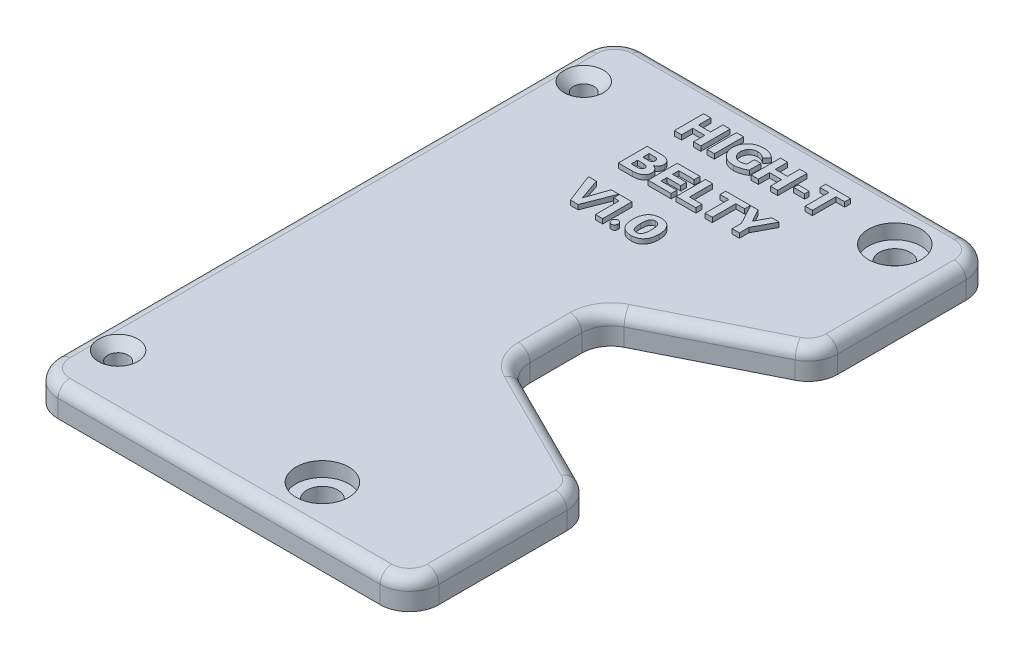
from build123d import *

# Parameters (mm, degrees)
SKETCH2_W           = 65
SKETCH2_H           = 100
SKETCH2_R           = 1.75
SKETCH2_R_2         = 2.65
BOSS_EXTRUDE1_DEPTH = 5
SKETCH3_R           = 4.5
CUT_EXTRUDE1_DEPTH  = 2.5
FILLET1_R           = 5
CHAMFER1_SIZE       = 1.6
CUT_EXTRUDE2_DEPTH  = 60.843546018
FILLET3_R           = 5
FILLET2_R           = 2
SKETCH4_W           = 1.231467233
SKETCH4_H           = 5
SKETCH4_W_2         = 1.890445816
SKETCH4_H_2         = 0.775761863
BOSS_EXTRUDE2_DEPTH = 0.8


with BuildPart() as part:
    # Sketch2 → Boss-Extrude1 (new body)
    with BuildSketch(Plane(origin=(0, 0, 0), x_dir=(1, 0, 0), z_dir=(0, 1, 0))):
        Rectangle(SKETCH2_W, SKETCH2_H)
        with Locations(Location((-27.5, 39.75, 0), (0, 0, 270))):
            Circle(SKETCH2_R, mode=Mode.SUBTRACT)
        with Locations(Location((-27.5, -39.75, 0), (0, 0, 270))):
            Circle(SKETCH2_R, mode=Mode.SUBTRACT)
        with Locations(Location((23.15, 42.205, 0), (0, 0, 270))):
            Circle(SKETCH2_R_2, mode=Mode.SUBTRACT)
        with Locations(Location((9.4375, -41.8075, 0), (0, 0, 270))):
            Circle(SKETCH2_R_2, mode=Mode.SUBTRACT)
    extrude(amount=BOSS_EXTRUDE1_DEPTH)

    # Sketch3 → Cut-Extrude1 (cut)
    with BuildSketch(Plane(origin=(0, 5, 0), x_dir=(1, 0, 0), z_dir=(0, 1, 0))):
        with Locations(Location((23.15, 42.205, 0), (0, 0, 270))):
            Circle(SKETCH3_R)
        with Locations(Location((9.4375, -41.8075, 0), (0, 0, 270))):
            Circle(SKETCH3_R)
    extrude(amount=-CUT_EXTRUDE1_DEPTH, mode=Mode.SUBTRACT)

    # Fillet1
    fillet1_edges = [part.edges().sort_by_distance(p)[0] for p in [
        (32.5, 2.5, 50),
        (-32.5, 2.5, 50),
        (-32.5, 2.5, -50),
        (32.5, 2.5, -50),
    ]]
    fillet(fillet1_edges, radius=FILLET1_R)

    # Chamfer1
    chamfer1_edges = [part.edges().sort_by_distance(p)[0] for p in [
        (-27.5, 5, -41.5),
        (-27.5, 5, 38),
    ]]
    chamfer(chamfer1_edges, length=CHAMFER1_SIZE)

    # Sketch6 → Cut-Extrude2 (cut, through all)
    with BuildSketch(Plane(origin=(0, 5, 0), x_dir=(1, 0, 0), z_dir=(0, 1, 0))):
        Polygon((7.5, 7.5), (32.5, 20), (32.5, -20), (7.5, -7.5), align=None)
    extrude(amount=-CUT_EXTRUDE2_DEPTH, mode=Mode.SUBTRACT)

    # Fillet3
    fillet3_edges = [part.edges().sort_by_distance(p)[0] for p in [
        (7.5, 2.5, 7.5),
        (7.5, 2.5, -7.5),
        (32.5, 2.5, -20),
        (32.5, 2.5, 20),
    ]]
    fillet(fillet3_edges, radius=FILLET3_R)

    # Fillet2
    # the kernel refuses this fillet: 2 mm, written as the material it takes off along each edge
    with BuildSketch(Plane(origin=(12.5, 5, -4.409830056), x_dir=(-1, 0, 0), z_dir=(0, 0, 1))) as fillet2_piece_1:
        with BuildLine():
            CenterArc((5 + FILLET2_R, FILLET2_R), FILLET2_R, 180, 90)
            Line((5, FILLET2_R), (5, 0))
            Line((5, 0), (5 + FILLET2_R, 0))
        make_face()
    revolve(axis=Axis((12.5, 5, -4.409830056), (0, -1, 0)), revolution_arc=63.434948823, mode=Mode.SUBTRACT)
    with BuildSketch(Plane(origin=(12.5, 5, 4.409830056), x_dir=(-0.447213595499958, 0, 0.894427190999916), z_dir=(0.894427190999916, 0, 0.447213595499958))) as fillet2_piece_2:
        with BuildLine():
            CenterArc((5 + FILLET2_R, FILLET2_R), FILLET2_R, 180, 90)
            Line((5, FILLET2_R), (5, 0))
            Line((5, 0), (5 + FILLET2_R, 0))
        make_face()
    revolve(axis=Axis((12.5, 5, 4.409830056), (0, -1, 0)), revolution_arc=63.434948823, mode=Mode.SUBTRACT)
    with BuildSketch(Plane(origin=(27.5, 5, 50), x_dir=(0, 0, -1), z_dir=(-1, 0, 0)), Plane(origin=(-27.5, 5, -50), x_dir=(0, 0, 1), z_dir=(1, 0, 0))) as fillet2_piece_3:
        with BuildLine():
            CenterArc((FILLET2_R, FILLET2_R), FILLET2_R, 180, 90)
            Line((0, FILLET2_R), (0, 0))
            Line((0, 0), (FILLET2_R, 0))
        make_face()
    extrude(amount=55, mode=Mode.SUBTRACT)
    with BuildSketch(Plane(origin=(-32.5, 5, 45), x_dir=(1, 0, 0), z_dir=(0, 0, -1))) as fillet2_piece_4:
        with BuildLine():
            CenterArc((FILLET2_R, FILLET2_R), FILLET2_R, 180, 90)
            Line((0, FILLET2_R), (0, 0))
            Line((0, 0), (FILLET2_R, 0))
        make_face()
    extrude(amount=90, mode=Mode.SUBTRACT)
    with BuildSketch(Plane(origin=(32.5, 5, 23.090169944), x_dir=(-1, 0, 0), z_dir=(0, 0, 1)), Plane(origin=(32.5, 5, -45), x_dir=(-1, 0, 0), z_dir=(0, 0, 1))) as fillet2_piece_5:
        with BuildLine():
            CenterArc((FILLET2_R, FILLET2_R), FILLET2_R, 180, 90)
            Line((0, FILLET2_R), (0, 0))
            Line((0, 0), (FILLET2_R, 0))
        make_face()
    extrude(amount=21.909830056, mode=Mode.SUBTRACT)
    with BuildSketch(Plane(origin=(27.5, 5, 45), x_dir=(1, 0, 0), z_dir=(0, 0, -1))) as fillet2_piece_6:
        with BuildLine():
            CenterArc((5 - FILLET2_R, FILLET2_R), FILLET2_R, 270, 90)
            Line((5, FILLET2_R), (5, 0))
            Line((5, 0), (5 - FILLET2_R, 0))
        make_face()
    revolve(axis=Axis((27.5, 5, 45), (0, -1, 0)), revolution_arc=90, mode=Mode.SUBTRACT)
    with BuildSketch(Plane(origin=(27.5, 5, -45), x_dir=(0, 0, -1), z_dir=(-1, 0, 0))) as fillet2_piece_7:
        with BuildLine():
            CenterArc((5 - FILLET2_R, FILLET2_R), FILLET2_R, 270, 90)
            Line((5, FILLET2_R), (5, 0))
            Line((5, 0), (5 - FILLET2_R, 0))
        make_face()
    revolve(axis=Axis((27.5, 5, -45), (0, -1, 0)), revolution_arc=90, mode=Mode.SUBTRACT)
    with BuildSketch(Plane(origin=(-27.5, 5, -45), x_dir=(0, 0, -1), z_dir=(1, 0, 0))) as fillet2_piece_8:
        with BuildLine():
            CenterArc((5 - FILLET2_R, -FILLET2_R), FILLET2_R, 0, 90)
            Line((5, -FILLET2_R), (5, 0))
            Line((5, 0), (5 - FILLET2_R, 0))
        make_face()
    revolve(axis=Axis((-27.5, 5, -45), (0, 1, 0)), revolution_arc=90, mode=Mode.SUBTRACT)
    with BuildSketch(Plane(origin=(-27.5, 5, 45), x_dir=(-1, 0, 0), z_dir=(0, 0, -1))) as fillet2_piece_9:
        with BuildLine():
            CenterArc((5 - FILLET2_R, -FILLET2_R), FILLET2_R, 0, 90)
            Line((5, -FILLET2_R), (5, 0))
            Line((5, 0), (5 - FILLET2_R, 0))
        make_face()
    revolve(axis=Axis((-27.5, 5, 45), (0, 1, 0)), revolution_arc=90, mode=Mode.SUBTRACT)
    with BuildSketch(Plane(origin=(10.263932023, 5, -8.881966011), x_dir=(-0.44721359549995804, 0, -0.8944271909999159), z_dir=(0.8944271909999159, 0, -0.447213595499958)), Plane(origin=(29.736067977, 5, 18.618033989), x_dir=(-0.447213595499958, 0, 0.8944271909999159), z_dir=(-0.8944271909999159, 0, -0.447213595499958))) as fillet2_piece_10:
        with BuildLine():
            CenterArc((FILLET2_R, -FILLET2_R), FILLET2_R, 90, 90)
            Line((0, -FILLET2_R), (0, 0))
            Line((0, 0), (FILLET2_R, 0))
        make_face()
    extrude(amount=21.770509831, mode=Mode.SUBTRACT)
    with BuildSketch(Plane(origin=(7.5, 5, 4.409830056), x_dir=(-1, 0, 0), z_dir=(0, 0, -1))) as fillet2_piece_11:
        with BuildLine():
            CenterArc((FILLET2_R, -FILLET2_R), FILLET2_R, 90, 90)
            Line((0, -FILLET2_R), (0, 0))
            Line((0, 0), (FILLET2_R, 0))
        make_face()
    extrude(amount=8.819660113, mode=Mode.SUBTRACT)
    with BuildSketch(Plane(origin=(27.5, 5, 23.090169944), x_dir=(1, 0, 0), z_dir=(0, 0, 1))) as fillet2_piece_12:
        with BuildLine():
            CenterArc((5 - FILLET2_R, -FILLET2_R), FILLET2_R, 0, 90)
            Line((5, -FILLET2_R), (5, 0))
            Line((5, 0), (5 - FILLET2_R, 0))
        make_face()
    revolve(axis=Axis((27.5, 5, 23.090169944), (0, 1, 0)), revolution_arc=63.434948823, mode=Mode.SUBTRACT)
    with BuildSketch(Plane(origin=(27.5, 5, -23.090169944), x_dir=(0.447213595499958, 0, 0.894427190999916), z_dir=(-0.894427190999916, 0, 0.447213595499958))) as fillet2_piece_13:
        with BuildLine():
            CenterArc((5 - FILLET2_R, -FILLET2_R), FILLET2_R, 0, 90)
            Line((5, -FILLET2_R), (5, 0))
            Line((5, 0), (5 - FILLET2_R, 0))
        make_face()
    revolve(axis=Axis((27.5, 5, -23.090169944), (0, 1, 0)), revolution_arc=63.434948823, mode=Mode.SUBTRACT)

    # Sketch4 → Boss-Extrude2 (add)
    # profile 1 of 15: a face of its own
    with BuildSketch(Plane(origin=(0, 5, 0), x_dir=(1, 0, 0), z_dir=(0, 1, 0))):
        Polygon((-7.166483743, 39.40635341), (-7.166483743, 44.40635341), (-8.397950976, 44.40635341), (-8.397950976, 42.297622949), (-10.461375654, 42.297622949), (-10.461375654, 44.40635341), (-11.692842887, 44.40635341), (-11.692842887, 39.40635341), (-10.461375654, 39.40635341), (-10.461375654, 41.317391301), (-8.397950976, 41.317391301), (-8.397950976, 39.40635341), align=None)
    # profile 2 of 15: a face of its own
    with BuildSketch(Plane(origin=(0, 5, 0), x_dir=(1, 0, 0), z_dir=(0, 1, 0))):
        with Locations((-5.475791314, 41.90635341)):
            Rectangle(SKETCH4_W, SKETCH4_H)
    # profile 3 of 15: a face of its own
    with BuildSketch(Plane(origin=(0, 5, 0), x_dir=(1, 0, 0), z_dir=(0, 1, 0))):
        with BuildLine():
            Line((-0.556105836, 41.957400721), (-0.556105836, 40.634993116))
            add(Edge.make_bspline(
                [(-0.556105836, 40.634993116), (-0.633336255, 40.598588973), (-0.784947168, 40.527124058), (-0.982142373, 40.462368321), (-1.13658966, 40.422342839), (-1.248035296, 40.404046551), (-1.354358334, 40.388700079), (-1.424048895, 40.387279007), (-1.458080761, 40.386585058)],
                knots=[0, 0, 0, 0, 1.628199153, 3.196315169, 3.95256349, 4.670894267, 5.350960203, 6, 6, 6, 6], degree=3))
            add(Edge.make_bspline(
                [(-1.458080761, 40.386585058), (-1.511022372, 40.388648552), (-1.614635544, 40.39268706), (-1.766312975, 40.416071933), (-1.910455868, 40.45177804), (-2.047560246, 40.500767211), (-2.177564019, 40.561177574), (-2.300220724, 40.635299574), (-2.415979113, 40.721641369), (-2.522386397, 40.821923033), (-2.619986674, 40.93096029), (-2.704747572, 41.049282219), (-2.777536704, 41.174639772), (-2.8371516, 41.307966526), (-2.884701161, 41.448644137), (-2.919531349, 41.596872171), (-2.942882052, 41.752568065), (-2.946949194, 41.859249645), (-2.949019805, 41.913561994)],
                knots=[0, 0, 0, 0, 1.067772952, 2.089761565, 3.08863466, 4.058499339, 5.021522729, 5.974745117, 6.943794358, 7.928172758, 8.918592206, 9.890603398, 10.858193022, 11.837202932, 12.830954615, 13.84836214, 14.904585896, 16, 16, 16, 16], degree=3))
            add(Edge.make_bspline(
                [(-2.949019805, 41.913561994), (-2.946969615, 41.966853375), (-2.94293058, 42.071841572), (-2.919158148, 42.224945561), (-2.886132664, 42.371494272), (-2.837837332, 42.509639476), (-2.77964043, 42.641705889), (-2.70663793, 42.765178778), (-2.623140491, 42.882791903), (-2.526558325, 42.990868506), (-2.420905654, 43.089649342), (-2.306968608, 43.176954693), (-2.18540171, 43.250961457), (-2.056850204, 43.312490735), (-1.920810725, 43.359359484), (-1.778413588, 43.395867274), (-1.628348375, 43.418881351), (-1.525774476, 43.422997462), (-1.473525571, 43.425094119)],
                knots=[0, 0, 0, 0, 1.086646364, 2.140778484, 3.154281091, 4.145845613, 5.12011741, 6.092426418, 7.065490814, 8.057055335, 9.042500024, 10.011174974, 10.978635539, 11.939720885, 12.911450365, 13.907868944, 14.934314136, 16, 16, 16, 16], degree=3))
            add(Edge.make_bspline(
                [(-1.473525571, 43.425094119), (-1.413364463, 43.422853078), (-1.292429558, 43.418348174), (-1.111603072, 43.389740707), (-0.931838258, 43.342920716), (-0.754314018, 43.27928401), (-0.581987588, 43.199315552), (-0.418206206, 43.104248415), (-0.262665189, 42.995917982), (-0.16817464, 42.912264293), (-0.120560168, 42.870110594)],
                knots=[0, 0, 0, 0, 0.96562137, 1.94107673, 2.931153581, 3.943538676, 4.963910889, 5.975876231, 6.980029377, 8, 8, 8, 8], degree=3))
            Line((-0.120560168, 42.870110594), (0.593385249, 43.681477974))
            add(Edge.make_bspline(
                [(0.593385249, 43.681477974), (0.525574001, 43.743149713), (0.389861266, 43.86657526), (0.161508345, 44.023559988), (-0.083022078, 44.160745141), (-0.345351627, 44.271552152), (-0.617706092, 44.359465882), (-0.896570806, 44.424094187), (-1.180004755, 44.462984074), (-1.37078575, 44.468473719), (-1.466317993, 44.47122262)],
                knots=[0, 0, 0, 0, 0.972849732, 1.946994061, 2.936193159, 3.947412972, 4.966791559, 5.973392175, 6.985190369, 8, 8, 8, 8], degree=3))
            add(Edge.make_bspline(
                [(-1.466317993, 44.47122262), (-1.566307619, 44.467692848), (-1.762149568, 44.460779357), (-2.048085683, 44.42324015), (-2.319330878, 44.364235048), (-2.577131321, 44.285863322), (-2.819435914, 44.182711095), (-3.049142452, 44.061576238), (-3.262582949, 43.916138969), (-3.461073372, 43.752283139), (-3.639933529, 43.570235446), (-3.797461175, 43.373714915), (-3.932194012, 43.163765193), (-4.043239731, 42.939738128), (-4.129388235, 42.701847537), (-4.193252499, 42.450821685), (-4.235397973, 42.186744034), (-4.243360904, 42.005701481), (-4.247413545, 41.913561994)],
                knots=[0, 0, 0, 0, 1.136686362, 2.226339683, 3.272298926, 4.28902103, 5.283773391, 6.261078626, 7.23592056, 8.213879552, 9.182111569, 10.131288083, 11.071645943, 12.011971438, 12.967157077, 13.941678949, 14.952441609, 16, 16, 16, 16], degree=3))
            add(Edge.make_bspline(
                [(-4.247413545, 41.913561994), (-4.243163808, 41.820765726), (-4.234833054, 41.638857299), (-4.195613851, 41.372843774), (-4.132365611, 41.120687441), (-4.04838882, 40.881519079), (-3.940191112, 40.656365988), (-3.810202318, 40.444792976), (-3.657723314, 40.246299241), (-3.482827344, 40.064444658), (-3.291062423, 39.898386867), (-3.082738479, 39.754160457), (-2.86173366, 39.629138157), (-2.625620515, 39.529109643), (-2.377115856, 39.447668255), (-2.114547322, 39.390187839), (-1.838502069, 39.350442012), (-1.649395599, 39.343832423), (-1.552808932, 39.340456557)],
                knots=[0, 0, 0, 0, 1.070303225, 2.098114301, 3.093148994, 4.062915008, 5.014925995, 5.966904099, 6.920434657, 7.89421925, 8.870459961, 9.839547862, 10.810209228, 11.792029461, 12.790416868, 13.820296925, 14.886710456, 16, 16, 16, 16], degree=3))
            add(Edge.make_bspline(
                [(-1.552808932, 39.340456557), (-1.461050732, 39.342958399), (-1.275864852, 39.348007602), (-0.99807576, 39.385511078), (-0.717308571, 39.439153532), (-0.438711814, 39.516591587), (-0.167810466, 39.609586188), (0.087374557, 39.718129815), (0.324796501, 39.838506739), (0.470847394, 39.932637578), (0.542537031, 39.97884206)],
                knots=[0, 0, 0, 0, 0.991981442, 2.002011336, 3.026893716, 4.081264979, 5.125916695, 6.122062403, 7.078207169, 8, 8, 8, 8], degree=3))
            Line((0.542537031, 39.97884206), (0.54356568, 41.957400721))
            Line((0.54356568, 41.957400721), (-0.556105836, 41.957400721))
        make_face()
    # profile 4 of 15: a face of its own
    with BuildSketch(Plane(origin=(0, 5, 0), x_dir=(1, 0, 0), z_dir=(0, 1, 0))):
        Polygon((5.947190062, 39.40635341), (5.947190062, 44.40635341), (4.715722829, 44.40635341), (4.715722829, 42.297622949), (2.652298152, 42.297622949), (2.652298152, 44.40635341), (1.420830919, 44.40635341), (1.420830919, 39.40635341), (2.652298152, 39.40635341), (2.652298152, 41.317391301), (4.715722829, 41.317391301), (4.715722829, 39.40635341), align=None)
    # profile 5 of 15: a face of its own
    with BuildSketch(Plane(origin=(0, 5, 0), x_dir=(1, 0, 0), z_dir=(0, 1, 0))):
        with Locations((7.835576067, 41.576864119)):
            Rectangle(SKETCH4_W_2, SKETCH4_H_2)
    # profile 6 of 15: a face of its own
    with BuildSketch(Plane(origin=(0, 5, 0), x_dir=(1, 0, 0), z_dir=(0, 1, 0))):
        Polygon((13.379702474, 43.426121762), (13.379702474, 44.40635341), (9.159061088, 44.40635341), (9.159061088, 43.426121762), (10.646531084, 43.426121762), (10.646531084, 39.40635341), (11.877998316, 39.40635341), (11.877998316, 43.426121762), align=None)
    # profile 7 of 15: a face of its own
    with BuildSketch(Plane(origin=(0, 5, 0), x_dir=(1, 0, 0), z_dir=(0, 1, 0))):
        with BuildLine():
            Line((-11.692842887, 34.77373397), (-11.692842887, 29.842228085))
            Line((-11.692842887, 29.842228085), (-9.275099575, 29.842228085))
            add(Edge.make_bspline(
                [(-9.275099575, 29.842228085), (-9.202675299, 29.843533916), (-9.061662971, 29.846076411), (-8.856415662, 29.8650404), (-8.663035063, 29.894466453), (-8.481773911, 29.935697791), (-8.312069197, 29.986653957), (-8.154628414, 30.049776003), (-8.008860479, 30.123700042), (-7.875675433, 30.209249887), (-7.756508878, 30.304419501), (-7.652034792, 30.408562408), (-7.562840334, 30.520814491), (-7.490284062, 30.642543611), (-7.433194444, 30.772236034), (-7.391974837, 30.91055887), (-7.365812701, 31.05709661), (-7.361315902, 31.157824743), (-7.359028043, 31.209072702)],
                knots=[0, 0, 0, 0, 1.31778807, 2.565774578, 3.747698678, 4.87499037, 5.945847535, 6.968804334, 7.957633534, 8.915706071, 9.844314641, 10.727602835, 11.594778639, 12.446339008, 13.299295435, 14.166741106, 15.067283635, 16, 16, 16, 16], degree=3))
            add(Edge.make_bspline(
                [(-7.359028043, 31.209072702), (-7.359999721, 31.248255838), (-7.361907194, 31.325175035), (-7.377400443, 31.437567806), (-7.398304291, 31.545977119), (-7.429746457, 31.649325843), (-7.467231789, 31.749128322), (-7.515408597, 31.843147697), (-7.57110719, 31.933112847), (-7.634825941, 32.01819852), (-7.705382234, 32.0979524), (-7.784636008, 32.16847436), (-7.86810518, 32.234371531), (-7.958849665, 32.29190405), (-8.056248887, 32.34144949), (-8.159825323, 32.383266598), (-8.268837538, 32.420269001), (-8.344901603, 32.437125796), (-8.383533809, 32.4456872)],
                knots=[0, 0, 0, 0, 1.074137907, 2.108606731, 3.107339287, 4.099127461, 5.067591067, 6.027415709, 6.991293761, 7.966504418, 8.939759604, 9.90602486, 10.871969105, 11.853835331, 12.847364151, 13.864731711, 14.915517818, 16, 16, 16, 16], degree=3))
            add(Edge.make_bspline(
                [(-8.383533809, 32.4456872), (-8.323302329, 32.467100453), (-8.205274096, 32.509061375), (-8.045185713, 32.603981276), (-7.903876198, 32.719336725), (-7.804073132, 32.834032603), (-7.736078182, 32.935032411), (-7.69045858, 33.014776855), (-7.650996919, 33.097778236), (-7.620335904, 33.185326431), (-7.595559639, 33.276168741), (-7.576933799, 33.371088858), (-7.565436194, 33.469913435), (-7.563752128, 33.537089901), (-7.562899542, 33.571099061)],
                knots=[0, 0, 0, 0, 1.535350456, 3.008637708, 4.452220897, 5.909889534, 6.647551199, 7.380061954, 8.119063438, 8.855799671, 9.609200867, 10.383501593, 11.181621827, 12, 12, 12, 12], degree=3))
            add(Edge.make_bspline(
                [(-7.562899542, 33.571099061), (-7.564849765, 33.616854059), (-7.568676495, 33.706634544), (-7.593724027, 33.837248705), (-7.634746613, 33.959515193), (-7.687679035, 34.075521179), (-7.759019551, 34.181467385), (-7.843226687, 34.28073848), (-7.94317967, 34.371577638), (-8.057286135, 34.454441619), (-8.184679884, 34.528657251), (-8.323625695, 34.593317063), (-8.473720982, 34.64749073), (-8.634231214, 34.693383537), (-8.806192685, 34.72742265), (-8.989010751, 34.753430154), (-9.182979818, 34.768635527), (-9.316031258, 34.771324464), (-9.384357532, 34.772705322)],
                knots=[0, 0, 0, 0, 0.900623983, 1.767204946, 2.606846164, 3.434992404, 4.268851201, 5.112316324, 5.992174589, 6.920550345, 7.883462853, 8.889971672, 9.933005182, 11.021585561, 12.173010109, 13.380719405, 14.654913598, 16, 16, 16, 16], degree=3))
            Line((-9.384357532, 34.772705322), (-11.692842887, 34.77373397))
        make_face()
        with BuildLine():
            Line((-10.461375654, 33.85940018), (-9.453891356, 33.85940018))
            add(Edge.make_bspline(
                [(-9.453891356, 33.85940018), (-9.410321619, 33.857236569), (-9.327359525, 33.85311679), (-9.210153966, 33.827333375), (-9.106766194, 33.785298968), (-9.019226942, 33.72468492), (-8.947176301, 33.649078598), (-8.897446661, 33.556115272), (-8.865229914, 33.449985209), (-8.861968649, 33.374002929), (-8.860263627, 33.334278633)],
                knots=[0, 0, 0, 0, 1.167247538, 2.222581713, 3.199513825, 4.138258449, 5.055725772, 5.969498458, 6.938433482, 8, 8, 8, 8], degree=3))
            add(Edge.make_bspline(
                [(-8.860263627, 33.334278633), (-8.861961021, 33.294211171), (-8.865208418, 33.217555416), (-8.897626444, 33.110159346), (-8.947351237, 33.015388168), (-9.018987551, 32.936764367), (-9.106534835, 32.873181767), (-9.209578451, 32.827403848), (-9.32744796, 32.800857148), (-9.410644811, 32.796847457), (-9.454374006, 32.794739918)],
                knots=[0, 0, 0, 0, 1.059109356, 2.02625326, 2.946081382, 3.873747498, 4.818077888, 5.795265446, 6.841166865, 8, 8, 8, 8], degree=3))
            Line((-9.454374006, 32.794739918), (-10.461375654, 32.795125033))
            Line((-10.461375654, 32.795125033), (-10.461375654, 33.85940018))
        make_face(mode=Mode.SUBTRACT)
        with BuildLine():
            Line((-10.461375654, 31.884138624), (-9.453891356, 31.884138624))
            add(Edge.make_bspline(
                [(-9.453891356, 31.884138624), (-9.395237264, 31.882265563), (-9.284304676, 31.878723039), (-9.128361707, 31.851846029), (-8.992104752, 31.809743698), (-8.877697814, 31.748702307), (-8.784060275, 31.673595183), (-8.717396025, 31.581447741), (-8.675919083, 31.475242868), (-8.670515968, 31.399599006), (-8.667718323, 31.360431846)],
                knots=[0, 0, 0, 0, 1.331614951, 2.518485681, 3.583576256, 4.556730862, 5.448129178, 6.285560974, 7.112291376, 8, 8, 8, 8], degree=3))
            add(Edge.make_bspline(
                [(-8.667718323, 31.360431846), (-8.670502118, 31.319228066), (-8.675858386, 31.239948363), (-8.716844224, 31.128993975), (-8.782711634, 31.033470685), (-8.873471353, 30.954803096), (-8.985769554, 30.892610046), (-9.118308894, 30.849751274), (-9.269199016, 30.821121429), (-9.376314875, 30.818274489), (-9.432751272, 30.816774514)],
                knots=[0, 0, 0, 0, 0.93692351, 1.802723391, 2.657292488, 3.554717455, 4.513954865, 5.5623934, 6.715692222, 8, 8, 8, 8], degree=3))
            Line((-9.432751272, 30.816774514), (-10.461375654, 30.817268226))
            Line((-10.461375654, 30.817268226), (-10.461375654, 31.884138624))
        make_face(mode=Mode.SUBTRACT)
    # profile 8 of 15: a face of its own
    with BuildSketch(Plane(origin=(0, 5, 0), x_dir=(1, 0, 0), z_dir=(0, 1, 0))):
        Polygon((-2.753920476, 33.85940018), (-2.753920476, 34.839631829), (-6.618707796, 34.839631829), (-6.618707796, 29.839632834), (-2.675632581, 29.839632834), (-2.675632581, 30.819863477), (-5.387240563, 30.819863477), (-5.387240563, 31.816567578), (-3.010135403, 31.816567578), (-3.010135403, 32.796799226), (-5.387240563, 32.796799226), (-5.387240563, 33.85940018), align=None)
    # profile 9 of 15: a face of its own
    with BuildSketch(Plane(origin=(0, 5, 0), x_dir=(1, 0, 0), z_dir=(0, 1, 0))):
        Polygon((-0.576696906, 30.885761335), (-0.576696906, 34.839631829), (-1.808164139, 34.839631829), (-1.808164139, 29.839632834), (1.537076245, 29.839632834), (1.537076245, 30.885761335), align=None)
    # profile 10 of 15: a face of its own
    with BuildSketch(Plane(origin=(0, 5, 0), x_dir=(1, 0, 0), z_dir=(0, 1, 0))):
        Polygon((5.867346626, 33.85940018), (5.867346626, 34.839631829), (1.64670524, 34.839631829), (1.64670524, 33.85940018), (3.134175235, 33.85940018), (3.134175235, 29.839631829), (4.365642468, 29.839631829), (4.365642468, 33.85940018), align=None)
    # profile 11 of 15: a face of its own
    with BuildSketch(Plane(origin=(0, 5, 0), x_dir=(1, 0, 0), z_dir=(0, 1, 0))):
        Polygon((8.97849255, 31.454000651), (10.786231205, 34.839631829), (9.519390731, 34.839631829), (8.359259216, 32.661205655), (7.170541731, 34.839631829), (5.903701256, 34.839631829), (7.747025318, 31.418284526), (7.747025318, 29.839631829), (8.97849255, 29.839631829), align=None)
    # profile 12 of 15: a face of its own
    with BuildSketch(Plane(origin=(0, 5, 0), x_dir=(1, 0, 0), z_dir=(0, 1, 0))):
        Polygon((-8.984023216, 20.272910247), (-7.028510103, 25.272910247), (-8.329899291, 25.272910247), (-9.602596928, 21.594406849), (-10.875294565, 25.272910247), (-12.226202672, 25.272910247), (-10.292271067, 20.272910247), align=None)
    # profile 13 of 15: a face of its own
    with BuildSketch(Plane(origin=(0, 5, 0), x_dir=(1, 0, 0), z_dir=(0, 1, 0))):
        Polygon((-4.794159838, 20.272910247), (-4.794159838, 25.272910247), (-6.943730561, 25.272910247), (-6.943730561, 24.292678599), (-6.025627071, 24.292678599), (-6.025627071, 20.272910247), align=None)
    # profile 14 of 15: a face of its own
    with BuildSketch(Plane(origin=(0, 5, 0), x_dir=(1, 0, 0), z_dir=(0, 1, 0))):
        with BuildLine():
            add(Edge.make_bspline(
                [(-3.238617042, 21.384937612), (-3.278572662, 21.38235487), (-3.355035348, 21.377412303), (-3.463278999, 21.345469928), (-3.559072529, 21.294411492), (-3.640515573, 21.22346866), (-3.707544854, 21.137397027), (-3.754955544, 21.036004615), (-3.785729002, 20.92197912), (-3.790054514, 20.841147167), (-3.792306461, 20.799064465)],
                knots=[0, 0, 0, 0, 1.061686118, 2.031738492, 2.974724818, 3.925754286, 4.88202122, 5.85327426, 6.882372426, 8, 8, 8, 8], degree=3))
            add(Edge.make_bspline(
                [(-3.792306461, 20.799064465), (-3.790094565, 20.756288106), (-3.785861397, 20.674421905), (-3.75471817, 20.558828733), (-3.707827916, 20.455894076), (-3.640872843, 20.368487565), (-3.558757052, 20.297741226), (-3.463595491, 20.245266567), (-3.355293456, 20.213426777), (-3.279073467, 20.209209515), (-3.239382244, 20.207013394)],
                knots=[0, 0, 0, 0, 1.129108334, 2.160908789, 3.142827651, 4.100657081, 5.046081166, 5.987843506, 6.952178376, 8, 8, 8, 8], degree=3))
            add(Edge.make_bspline(
                [(-3.239382244, 20.207013394), (-3.199708307, 20.209281902), (-3.122862073, 20.213675877), (-3.013424559, 20.245022933), (-2.916972613, 20.297725462), (-2.833827674, 20.3684237), (-2.765813237, 20.455806216), (-2.717938693, 20.558744577), (-2.685415928, 20.674267809), (-2.681364883, 20.756265784), (-2.679250448, 20.799064465)],
                knots=[0, 0, 0, 0, 1.042086282, 2.018463865, 2.96298707, 3.910091179, 4.868171496, 5.848582598, 6.877071938, 8, 8, 8, 8], degree=3))
            add(Edge.make_bspline(
                [(-2.679250448, 20.799064465), (-2.681406181, 20.841169208), (-2.685551486, 20.922133292), (-2.717697603, 21.036093819), (-2.766101308, 21.137480296), (-2.834184428, 21.223528529), (-2.916658923, 21.2944296), (-3.013740894, 21.34570952), (-3.122875701, 21.377080505), (-3.199702054, 21.382261612), (-3.238617042, 21.384937612)],
                knots=[0, 0, 0, 0, 1.112383871, 2.139026045, 3.109680803, 4.067033311, 5.020501671, 5.967069083, 6.950007626, 8, 8, 8, 8], degree=3))
        make_face()
    # profile 15 of 15: a face of its own
    with BuildSketch(Plane(origin=(0, 5, 0), x_dir=(1, 0, 0), z_dir=(0, 1, 0))):
        with BuildLine():
            add(Edge.make_bspline(
                [(0.097554544, 25.338808105), (0.00897648, 25.336080231), (-0.162945508, 25.330785675), (-0.412561089, 25.300112138), (-0.645240608, 25.248606715), (-0.862638773, 25.178100476), (-1.06317347, 25.084424839), (-1.249060402, 24.97258915), (-1.416832573, 24.837877515), (-1.569216359, 24.68512076), (-1.703747309, 24.511680197), (-1.820111023, 24.3189421), (-1.919423352, 24.107851656), (-1.999089591, 23.877319246), (-2.063093573, 23.628806752), (-2.107702353, 23.361139165), (-2.134299942, 23.074791857), (-2.138549963, 22.877651178), (-2.140741387, 22.776000215)],
                knots=[0, 0, 0, 0, 1.096409004, 2.128030444, 3.107100493, 4.042022378, 4.950456384, 5.840692783, 6.720357151, 7.606438932, 8.505418822, 9.429889336, 10.387596845, 11.387121961, 12.44417627, 13.560120093, 14.741933196, 16, 16, 16, 16], degree=3))
            add(Edge.make_bspline(
                [(-2.140741387, 22.776000215), (-2.138553767, 22.674005042), (-2.134310704, 22.476177319), (-2.107654349, 22.188820096), (-2.063298369, 21.920398761), (-1.998653252, 21.671056667), (-1.919894153, 21.439524773), (-1.820098551, 21.22790112), (-1.703479925, 21.035030225), (-1.569224186, 20.860773534), (-1.417171242, 20.706897225), (-1.248978978, 20.572345735), (-1.063477525, 20.460037771), (-0.862144331, 20.368284934), (-0.645507381, 20.295749163), (-0.412512194, 20.244871657), (-0.163268817, 20.213753462), (0.008396772, 20.209302729), (0.096696834, 20.207013394)],
                knots=[0, 0, 0, 0, 1.260508634, 2.444856432, 3.563387867, 4.618931885, 5.625036649, 6.581375811, 7.504525467, 8.405571827, 9.293402139, 10.171809666, 11.060774119, 11.96613328, 12.901057835, 13.878729015, 14.908876502, 16, 16, 16, 16], degree=3))
            add(Edge.make_bspline(
                [(0.096696834, 20.207013394), (0.184310793, 20.209303864), (0.354608858, 20.213755923), (0.601809818, 20.244842542), (0.833055926, 20.295892495), (1.048311317, 20.368338045), (1.248549943, 20.459691502), (1.43230752, 20.573046031), (1.600315875, 20.706480786), (1.751264538, 20.861159317), (1.885499821, 21.035017885), (2.002476548, 21.227618162), (2.100306547, 21.440045662), (2.181444794, 21.670614682), (2.243844981, 21.920626798), (2.28883897, 22.188778179), (2.315308127, 22.476188853), (2.319577844, 22.674008966), (2.321779206, 22.776000215)],
                knots=[0, 0, 0, 0, 1.085681049, 2.110273105, 3.082380474, 4.015891933, 4.919923145, 5.80412315, 6.684991664, 7.572327157, 8.475897931, 9.401633925, 10.358848971, 11.369179262, 12.426628782, 13.548293946, 14.735959867, 16, 16, 16, 16], degree=3))
            add(Edge.make_bspline(
                [(2.321779206, 22.776000215), (2.319574075, 22.877647254), (2.315297469, 23.074780323), (2.288886554, 23.361181069), (2.243641073, 23.628578593), (2.181879626, 23.877763018), (2.099837821, 24.107329843), (2.002490168, 24.319225702), (1.885767156, 24.511692692), (1.751259358, 24.684735099), (1.5999757, 24.838294882), (1.432389052, 24.971888222), (1.248246112, 25.084775712), (1.048807534, 25.178042123), (0.832789581, 25.248481945), (0.601855763, 25.300077231), (0.354596303, 25.331002245), (0.184306528, 25.335477205), (0.096696834, 25.337779457)],
                knots=[0, 0, 0, 0, 1.261890846, 2.447296209, 3.566632073, 4.625845909, 5.629829614, 6.588641738, 7.515922289, 8.417634734, 9.303412473, 10.185750684, 11.071425944, 11.978757965, 12.912476687, 13.886205981, 14.912507532, 16, 16, 16, 16], degree=3))
            Line((0.096696834, 25.337779457), (0.097554544, 25.338808105))
        make_face()
        with BuildLine():
            add(Edge.make_bspline(
                [(0.097554544, 24.424474316), (0.136133307, 24.423731752), (0.211259818, 24.422285718), (0.31972873, 24.403993636), (0.421097382, 24.376111442), (0.513345514, 24.332627433), (0.599180121, 24.279254505), (0.67576722, 24.211256822), (0.744038735, 24.130820863), (0.805437717, 24.038460212), (0.857690313, 23.931492807), (0.904399157, 23.810805281), (0.941127366, 23.674189758), (0.973666009, 23.523824955), (0.996205606, 23.357838137), (1.014137869, 23.177230553), (1.022618595, 22.981326013), (1.023802456, 22.84602193), (1.02441512, 22.776000215)],
                knots=[0, 0, 0, 0, 0.863754462, 1.682035708, 2.45872179, 3.212555165, 3.959527121, 4.717236675, 5.49741999, 6.318877358, 7.196180508, 8.160537614, 9.215149271, 10.363363338, 11.606892301, 12.967157938, 14.430462726, 16, 16, 16, 16], degree=3))
            add(Edge.make_bspline(
                [(1.02441512, 22.776000215), (1.023800729, 22.705978728), (1.022613531, 22.570675087), (1.014155991, 22.374767475), (0.996111363, 22.193832163), (0.973768847, 22.027475793), (0.941150587, 21.876771174), (0.904209924, 21.739892107), (0.857688329, 21.618475933), (0.805453212, 21.510467086), (0.743987376, 21.417172964), (0.676152896, 21.335563492), (0.598819931, 21.267806529), (0.513717021, 21.212919407), (0.420861594, 21.170065746), (0.31994245, 21.140495517), (0.210967661, 21.122310346), (0.135555022, 21.121674047), (0.096696834, 21.121346178)],
                knots=[0, 0, 0, 0, 1.565000746, 3.024076057, 4.380410037, 5.627937928, 6.772833243, 7.824396693, 8.793129828, 9.674764851, 10.500252266, 11.284020532, 12.039540032, 12.788488992, 13.540143517, 14.316747044, 15.132663163, 16, 16, 16, 16], degree=3))
            add(Edge.make_bspline(
                [(0.096696834, 21.121346178), (0.057151892, 21.121671697), (-0.019626012, 21.122303703), (-0.130618398, 21.140540762), (-0.233356154, 21.169836897), (-0.327440145, 21.212980291), (-0.413610221, 21.267419072), (-0.490855348, 21.335976719), (-0.56012148, 21.41646786), (-0.619960542, 21.510903585), (-0.672883305, 21.61818062), (-0.717662504, 21.740167695), (-0.755083967, 21.87672297), (-0.787546394, 22.027490465), (-0.809936318, 22.193827706), (-0.827966602, 22.374768806), (-0.836428363, 22.570674715), (-0.837614954, 22.705978602), (-0.838229031, 22.776000215)],
                knots=[0, 0, 0, 0, 0.879551549, 1.70768048, 2.496200151, 3.252149216, 4.004884017, 4.757735234, 5.543694469, 6.362100825, 7.240622161, 8.203236876, 9.2510865, 10.391938366, 11.63506034, 12.986604129, 14.440526396, 16, 16, 16, 16], degree=3))
            add(Edge.make_bspline(
                [(-0.838229031, 22.776000215), (-0.837616684, 22.846022059), (-0.836433435, 22.981326391), (-0.827948454, 23.177229199), (-0.810030623, 23.357842658), (-0.787443511, 23.523810138), (-0.755061729, 23.674238781), (-0.717849874, 23.810526593), (-0.672882573, 23.931789509), (-0.619949633, 24.038021978), (-0.56016403, 24.131527535), (-0.490471999, 24.210839961), (-0.413966321, 24.279643561), (-0.327070952, 24.332559523), (-0.233588768, 24.376356538), (-0.130405542, 24.403882485), (-0.019658561, 24.422594616), (0.057140827, 24.423157009), (0.096696834, 24.423446673)],
                knots=[0, 0, 0, 0, 1.563378659, 3.020941671, 4.375869842, 5.614519396, 6.758228053, 7.808701581, 8.766550623, 9.640411375, 10.454436553, 11.236567072, 11.991303493, 12.741826964, 13.49966899, 14.288043342, 15.118245979, 16, 16, 16, 16], degree=3))
            Line((0.096696834, 24.423446673), (0.097554544, 24.424474316))
        make_face(mode=Mode.SUBTRACT)
    extrude(amount=BOSS_EXTRUDE2_DEPTH)


solid = part.part
